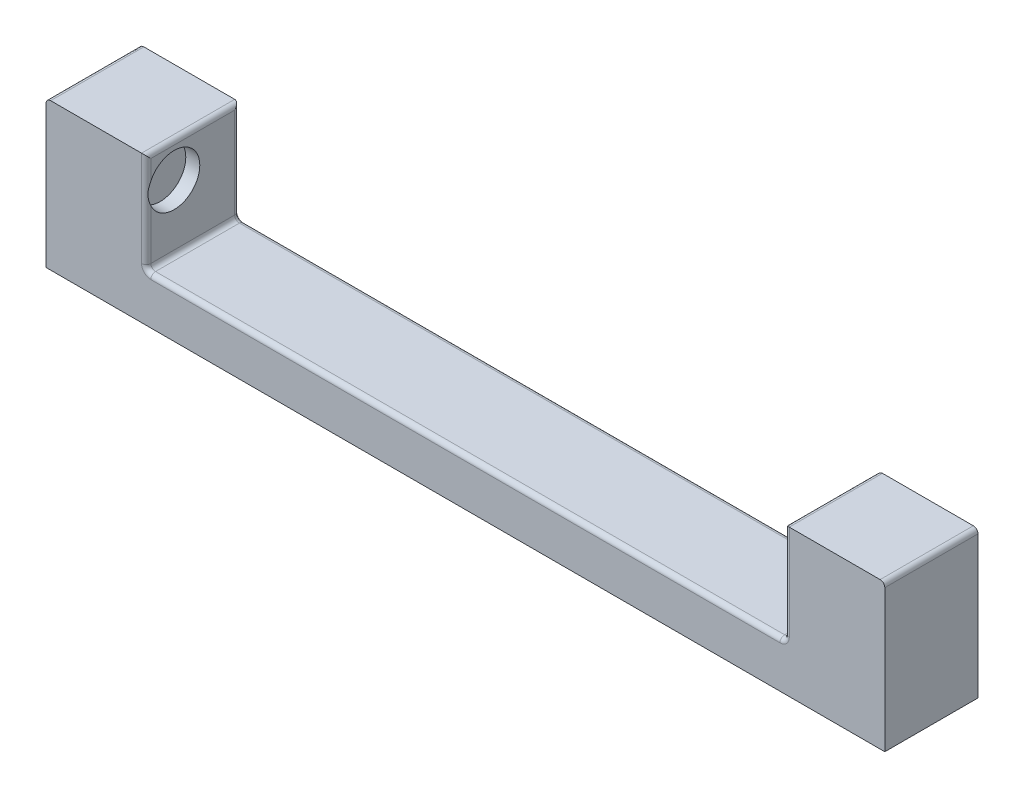
from build123d import *

# Parameters (mm, degrees)
ESQUISSE1_W             = 10.75
ESQUISSE1_H             = 10.75
BOSS_EXTRU_1_DEPTH      = 10
BOSS_EXTRU_1_2_DEPTH    = 10
ESQUISSE3_W             = 90
ESQUISSE3_H             = 10
BOSS_EXTRU_2_DEPTH      = 5
ESQUISSE4_R             = 2.75
ENL_V_MAT_EXTRU_1_DEPTH = 1.5
CONG_1_R                = 0.5


with BuildPart() as part:
    # Esquisse1 → Boss.-Extru.1 (new body)
    with BuildSketch(Plane.XY):
        with Locations((-39.625, 5.375)):
            Rectangle(ESQUISSE1_W, ESQUISSE1_H)
    extrude(amount=BOSS_EXTRU_1_DEPTH)



with BuildPart() as body_2:
    # Esquisse1 → Boss.-Extru.1 2 (new body)
    with BuildSketch(Plane.XY):
        with Locations((39.625, 5.375)):
            Rectangle(ESQUISSE1_W, ESQUISSE1_H)
    extrude(amount=BOSS_EXTRU_1_2_DEPTH)


with BuildPart() as part_1:
    add(part.part)

    add(body_2.part)  # Boss.-Extru.2 merges body 2
    # Esquisse3 → Boss.-Extru.2 (add)
    with BuildSketch(Plane.XZ):
        with Locations((0, 5)):
            Rectangle(ESQUISSE3_W, ESQUISSE3_H)
    extrude(amount=BOSS_EXTRU_2_DEPTH)

    # Esquisse4 → Enlèv. mat.-Extru.1 (cut)
    with BuildSketch(Plane(origin=(-34.25, 0, 0), x_dir=(0, 0, -1), z_dir=(1, 0, 0))):
        with Locations((-7, 7)):
            Circle(ESQUISSE4_R)
    enl_v_mat_extru_1 = extrude(amount=-ENL_V_MAT_EXTRU_1_DEPTH, mode=Mode.SUBTRACT)

    # Symétrie1: Enlèv. mat.-Extru.1 across plane
    add(enl_v_mat_extru_1.mirror(Plane(origin=(0, 0, 0), x_dir=(0, 0, 1), z_dir=(1, 0, 0))), mode=Mode.SUBTRACT)

    # Congé1
    # the kernel refuses this fillet: 0.5 mm, written as the material it adds along each edge
    with BuildSketch(Plane(origin=(34.25, 0, 0), x_dir=(-1, 0, 0), z_dir=(0, 0, 1)), Plane(origin=(-34.25, 0, 0), x_dir=(0, 1, 0), z_dir=(0, 0, 1))) as cong_1_piece_1:
        with BuildLine():
            CenterArc((CONG_1_R, -CONG_1_R), CONG_1_R, 90, 90)
            Line((0, -CONG_1_R), (0, 0))
            Line((0, 0), (CONG_1_R, 0))
        make_face()
    extrude(amount=10)
    # the kernel refuses this fillet: 0.5 mm, written as the material it takes off along each edge
    with BuildSketch(Plane(origin=(33.75, 0, 0), x_dir=(0, -1, 0), z_dir=(-1, 0, 0)), Plane(origin=(-33.75, 0, 10), x_dir=(0, -1, 0), z_dir=(1, 0, 0))) as cong_1_2_piece_1:
        with BuildLine():
            CenterArc((CONG_1_R, CONG_1_R), CONG_1_R, 180, 90)
            Line((0, CONG_1_R), (0, 0))
            Line((0, 0), (CONG_1_R, 0))
        make_face()
    extrude(amount=67.5, mode=Mode.SUBTRACT)
    with BuildSketch(Plane(origin=(34.25, 12, 0), x_dir=(1, 0, 0), z_dir=(0, -1, 0)), Plane(origin=(-34.25, 0.5, 10), x_dir=(0, 0, -1), z_dir=(0, 1, 0))) as cong_1_2_piece_2:
        with BuildLine():
            CenterArc((CONG_1_R, CONG_1_R), CONG_1_R, 180, 90)
            Line((0, CONG_1_R), (0, 0))
            Line((0, 0), (CONG_1_R, 0))
        make_face()
    extrude(amount=11.5, mode=Mode.SUBTRACT)
    with BuildSketch(Plane(origin=(34.25, 10.75, -1.25), x_dir=(1, 0, 0), z_dir=(0, 0, 1)), Plane(origin=(45, 10.75, -1.25), x_dir=(0, -1, 0), z_dir=(0, 0, 1)), Plane(origin=(-45, 10.75, -1.25), x_dir=(1, 0, 0), z_dir=(0, 0, 1))) as cong_1_2_piece_3:
        with BuildLine():
            CenterArc((CONG_1_R, -CONG_1_R), CONG_1_R, 90, 90)
            Line((0, -CONG_1_R), (0, 0))
            Line((0, 0), (CONG_1_R, 0))
        make_face()
    extrude(amount=12.5, mode=Mode.SUBTRACT)
    with BuildSketch(Plane(origin=(34.25, 12, 10), x_dir=(1, 0, 0), z_dir=(0, -1, 0)), Plane(origin=(-34.25, 0.5, 0), x_dir=(0, 0, 1), z_dir=(0, 1, 0))) as cong_1_2_piece_4:
        with BuildLine():
            CenterArc((CONG_1_R, -CONG_1_R), CONG_1_R, 90, 90)
            Line((0, -CONG_1_R), (0, 0))
            Line((0, 0), (CONG_1_R, 0))
        make_face()
    extrude(amount=11.5, mode=Mode.SUBTRACT)
    with BuildSketch(Plane(origin=(-34.25, 10.75, -1.25), x_dir=(-1, 0, 0), z_dir=(0, 0, 1))) as cong_1_2_piece_5:
        with BuildLine():
            CenterArc((CONG_1_R, CONG_1_R), CONG_1_R, 180, 90)
            Line((0, CONG_1_R), (0, 0))
            Line((0, 0), (CONG_1_R, 0))
        make_face()
    extrude(amount=12.5, mode=Mode.SUBTRACT)
    with BuildSketch(Plane(origin=(-33.75, 0.5, 0), x_dir=(-1, 0, 0), z_dir=(0, 1, 0))) as cong_1_2_piece_6:
        with BuildLine():
            CenterArc((0.5 + CONG_1_R, CONG_1_R), CONG_1_R, 180, 90)
            Line((0.5, CONG_1_R), (0.5, 0))
            Line((0.5, 0), (0.5 + CONG_1_R, 0))
        make_face()
    revolve(axis=Axis((-33.75, 0.5, 0), (0, 0, 1)), revolution_arc=90, mode=Mode.SUBTRACT)
    with BuildSketch(Plane(origin=(-33.75, 0.5, 10), x_dir=(-1, 0, 0), z_dir=(0, 1, 0))) as cong_1_2_piece_7:
        with BuildLine():
            CenterArc((0.5 + CONG_1_R, -CONG_1_R), CONG_1_R, 90, 90)
            Line((0.5, -CONG_1_R), (0.5, 0))
            Line((0.5, 0), (0.5 + CONG_1_R, 0))
        make_face()
    revolve(axis=Axis((-33.75, 0.5, 10), (0, 0, 1)), revolution_arc=90, mode=Mode.SUBTRACT)
    with BuildSketch(Plane(origin=(33.75, 0.5, 10), x_dir=(0, -1, 0), z_dir=(-1, 0, 0))) as cong_1_2_piece_8:
        with BuildLine():
            CenterArc((0.5 + CONG_1_R, -CONG_1_R), CONG_1_R, 90, 90)
            Line((0.5, -CONG_1_R), (0.5, 0))
            Line((0.5, 0), (0.5 + CONG_1_R, 0))
        make_face()
    revolve(axis=Axis((33.75, 0.5, 10), (0, 0, 1)), revolution_arc=90, mode=Mode.SUBTRACT)
    with BuildSketch(Plane(origin=(33.75, 0.5, 0), x_dir=(0, -1, 0), z_dir=(-1, 0, 0))) as cong_1_2_piece_9:
        with BuildLine():
            CenterArc((0.5 + CONG_1_R, CONG_1_R), CONG_1_R, 180, 90)
            Line((0.5, CONG_1_R), (0.5, 0))
            Line((0.5, 0), (0.5 + CONG_1_R, 0))
        make_face()
    revolve(axis=Axis((33.75, 0.5, 0), (0, 0, 1)), revolution_arc=90, mode=Mode.SUBTRACT)


solid = part_1.part
